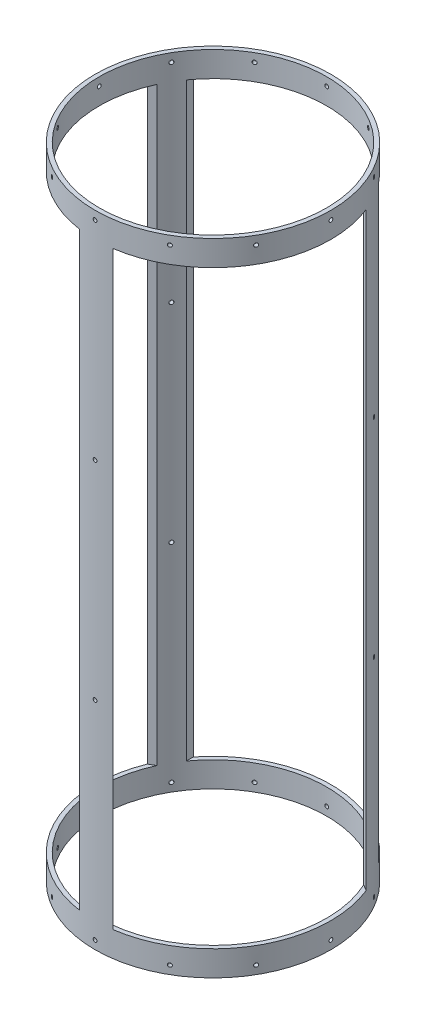
from build123d import *

# Parameters (mm, degrees)
SKETCH1_R                = 88.9
SKETCH1_R_2              = 85.725
BOSS_EXTRUDE1_DEPTH      = 241.427
CUT_EXTRUDE1_REACH       = 274.201
CUT_EXTRUDE1_END_RADIUS  = 88.9
SKETCH2_W                = 139.7
SKETCH2_H                = 444.754
CIRPATTERN1_COUNT        = 3
SKETCH4_R                = 1.4351
CUT_EXTRUDE3_DEPTH       = 15.24
CIRPATTERN3_COUNT        = 12
MIRROR1_COPY_1_SKETCH_R  = 1.4351
MIRROR1_COPY_1_DEPTH     = 15.24
MIRROR1_COPY_2_SKETCH_R  = 1.4351
MIRROR1_COPY_2_DEPTH     = 15.24
MIRROR1_COPY_3_SKETCH_R  = 1.4351
MIRROR1_COPY_3_DEPTH     = 15.24
MIRROR1_COPY_4_SKETCH_R  = 1.4351
MIRROR1_COPY_4_DEPTH     = 15.24
MIRROR1_COPY_5_SKETCH_R  = 1.4351
MIRROR1_COPY_5_DEPTH     = 15.24
MIRROR1_COPY_6_SKETCH_R  = 1.4351
MIRROR1_COPY_6_DEPTH     = 15.24
MIRROR1_COPY_7_SKETCH_R  = 1.4351
MIRROR1_COPY_7_DEPTH     = 15.24
MIRROR1_COPY_8_SKETCH_R  = 1.4351
MIRROR1_COPY_8_DEPTH     = 15.24
MIRROR1_COPY_9_SKETCH_R  = 1.4351
MIRROR1_COPY_9_DEPTH     = 15.24
MIRROR1_COPY_10_SKETCH_R = 1.4351
MIRROR1_COPY_10_DEPTH    = 15.24
MIRROR1_COPY_11_SKETCH_R = 1.4351
MIRROR1_COPY_11_DEPTH    = 15.24
SKETCH5_R                = 1.4351
CUT_EXTRUDE4_DEPTH       = 22.86
CIRPATTERN4_COUNT        = 3


with BuildPart() as part:
    # Sketch1 → Boss-Extrude1 (new, symmetric)
    with BuildSketch(Plane(origin=(0, 0, 0), x_dir=(1, 0, 0), z_dir=(0, 1, 0))):
        Circle(SKETCH1_R)
        Circle(SKETCH1_R_2, mode=Mode.SUBTRACT)
    extrude(amount=BOSS_EXTRUDE1_DEPTH, both=True)

    # Cut-Extrude1: up to this cylinder (the profile starts inside it)
    cut_extrude1_end = Plane(origin=(0, 0, 0), z_dir=(0, -1, 0)) * Cylinder(CUT_EXTRUDE1_END_RADIUS, 727.202, mode=Mode.PRIVATE)
    # Sketch2 → Cut-Extrude1 (cut, up to the surface)
    with BuildSketch(Plane.XY, mode=Mode.PRIVATE) as cut_extrude1_sk1:
        Rectangle(SKETCH2_W, SKETCH2_H)
    cut_extrude1_tool1 = extrude(cut_extrude1_sk1.sketch, amount=-CUT_EXTRUDE1_REACH, mode=Mode.PRIVATE) & cut_extrude1_end
    cut_extrude1 = cut_extrude1_tool1.solids().sort_by_distance((0, 0, 0))[0]
    add(cut_extrude1, mode=Mode.SUBTRACT)

    # CirPattern1: Cut-Extrude1 ×3 about axis
    cirpattern1_axis = Axis((0, 241.427, 0), (0, -1, 0))
    for i in range(1, CIRPATTERN1_COUNT):
        add(cut_extrude1.rotate(cirpattern1_axis, i * 360 / CIRPATTERN1_COUNT), mode=Mode.SUBTRACT)

    # Sketch4 → Cut-Extrude3 (cut)
    with BuildSketch(Plane(origin=(88.9, 0, 0), x_dir=(0, 0, -1), z_dir=(1, 0, 0))):
        with Locations((0, 235.077)):
            Circle(SKETCH4_R)
    cut_extrude3 = extrude(amount=-CUT_EXTRUDE3_DEPTH, mode=Mode.SUBTRACT)

    # CirPattern3: Cut-Extrude3 ×12 about axis
    cirpattern3_axis = Axis((0, 241.427, 0), (0, -1, 0))
    for i in range(1, CIRPATTERN3_COUNT):
        add(cut_extrude3.rotate(cirpattern3_axis, i * 360 / CIRPATTERN3_COUNT), mode=Mode.SUBTRACT)

    # Mirror1: Cut-Extrude3 across plane
    add(cut_extrude3.mirror(Plane.ZX), mode=Mode.SUBTRACT)

    # Mirror1 copy 1 sketch → Mirror1 copy 1 (cut)
    with BuildSketch(Plane(origin=(76.989658396, 0, 44.45), x_dir=(0.49999999999999994, 0, -0.8660254037844387), z_dir=(0.8660254037844387, 0, 0.49999999999999994))):
        with Locations((0, -235.077)):
            Circle(MIRROR1_COPY_1_SKETCH_R)
    extrude(amount=-MIRROR1_COPY_1_DEPTH, mode=Mode.SUBTRACT)

    # Mirror1 copy 2 sketch → Mirror1 copy 2 (cut)
    with BuildSketch(Plane(origin=(44.45, 0, 76.989658396), x_dir=(0.8660254037844386, 0, -0.5000000000000001), z_dir=(0.5000000000000001, 0, 0.8660254037844386))):
        with Locations((0, -235.077)):
            Circle(MIRROR1_COPY_2_SKETCH_R)
    extrude(amount=-MIRROR1_COPY_2_DEPTH, mode=Mode.SUBTRACT)

    # Mirror1 copy 3 sketch → Mirror1 copy 3 (cut)
    with BuildSketch(Plane.XY.offset(88.9)):
        with Locations((0, -235.077)):
            Circle(MIRROR1_COPY_3_SKETCH_R)
    extrude(amount=-MIRROR1_COPY_3_DEPTH, mode=Mode.SUBTRACT)

    # Mirror1 copy 4 sketch → Mirror1 copy 4 (cut)
    with BuildSketch(Plane(origin=(-44.45, 0, 76.989658396), x_dir=(0.8660254037844387, 0, 0.4999999999999998), z_dir=(-0.4999999999999998, 0, 0.8660254037844387))):
        with Locations((0, -235.077)):
            Circle(MIRROR1_COPY_4_SKETCH_R)
    extrude(amount=-MIRROR1_COPY_4_DEPTH, mode=Mode.SUBTRACT)

    # Mirror1 copy 5 sketch → Mirror1 copy 5 (cut)
    with BuildSketch(Plane(origin=(-76.989658396, 0, 44.45), x_dir=(0.49999999999999994, 0, 0.8660254037844387), z_dir=(-0.8660254037844387, 0, 0.49999999999999994))):
        with Locations((0, -235.077)):
            Circle(MIRROR1_COPY_5_SKETCH_R)
    extrude(amount=-MIRROR1_COPY_5_DEPTH, mode=Mode.SUBTRACT)

    # Mirror1 copy 6 sketch → Mirror1 copy 6 (cut)
    with BuildSketch(Plane.ZY.offset(88.9)):
        with Locations((0, -235.077)):
            Circle(MIRROR1_COPY_6_SKETCH_R)
    extrude(amount=-MIRROR1_COPY_6_DEPTH, mode=Mode.SUBTRACT)

    # Mirror1 copy 7 sketch → Mirror1 copy 7 (cut)
    with BuildSketch(Plane(origin=(-76.989658396, 0, -44.45), x_dir=(-0.5000000000000001, 0, 0.8660254037844386), z_dir=(-0.8660254037844386, 0, -0.5000000000000001))):
        with Locations((0, -235.077)):
            Circle(MIRROR1_COPY_7_SKETCH_R)
    extrude(amount=-MIRROR1_COPY_7_DEPTH, mode=Mode.SUBTRACT)

    # Mirror1 copy 8 sketch → Mirror1 copy 8 (cut)
    with BuildSketch(Plane(origin=(-44.45, 0, -76.989658396), x_dir=(-0.8660254037844384, 0, 0.5000000000000004), z_dir=(-0.5000000000000004, 0, -0.8660254037844384))):
        with Locations((0, -235.077)):
            Circle(MIRROR1_COPY_8_SKETCH_R)
    extrude(amount=-MIRROR1_COPY_8_DEPTH, mode=Mode.SUBTRACT)

    # Mirror1 copy 9 sketch → Mirror1 copy 9 (cut)
    with BuildSketch(Plane(origin=(0, 0, -88.9), x_dir=(-1, 0, 0), z_dir=(0, 0, -1))):
        with Locations((0, -235.077)):
            Circle(MIRROR1_COPY_9_SKETCH_R)
    extrude(amount=-MIRROR1_COPY_9_DEPTH, mode=Mode.SUBTRACT)

    # Mirror1 copy 10 sketch → Mirror1 copy 10 (cut)
    with BuildSketch(Plane(origin=(44.45, 0, -76.989658396), x_dir=(-0.8660254037844386, 0, -0.5000000000000001), z_dir=(0.5000000000000001, 0, -0.8660254037844386))):
        with Locations((0, -235.077)):
            Circle(MIRROR1_COPY_10_SKETCH_R)
    extrude(amount=-MIRROR1_COPY_10_DEPTH, mode=Mode.SUBTRACT)

    # Mirror1 copy 11 sketch → Mirror1 copy 11 (cut)
    with BuildSketch(Plane(origin=(76.989658396, 0, -44.45), x_dir=(-0.5000000000000004, 0, -0.8660254037844384), z_dir=(0.8660254037844384, 0, -0.5000000000000004))):
        with Locations((0, -235.077)):
            Circle(MIRROR1_COPY_11_SKETCH_R)
    extrude(amount=-MIRROR1_COPY_11_DEPTH, mode=Mode.SUBTRACT)

    # Sketch5 → Cut-Extrude4 (cut)
    with BuildSketch(Plane.XY.offset(88.9)):
        with Locations((0, 78.359)):
            Circle(SKETCH5_R)
        with Locations((0, -78.359)):
            Circle(SKETCH5_R)
    cut_extrude4 = extrude(amount=-CUT_EXTRUDE4_DEPTH, mode=Mode.SUBTRACT)

    # CirPattern4: Cut-Extrude4 ×3 about axis
    cirpattern4_axis = Axis((0, 241.427, 0), (0, -1, 0))
    for i in range(1, CIRPATTERN4_COUNT):
        add(cut_extrude4.rotate(cirpattern4_axis, i * 360 / CIRPATTERN4_COUNT), mode=Mode.SUBTRACT)


solid = part.part
